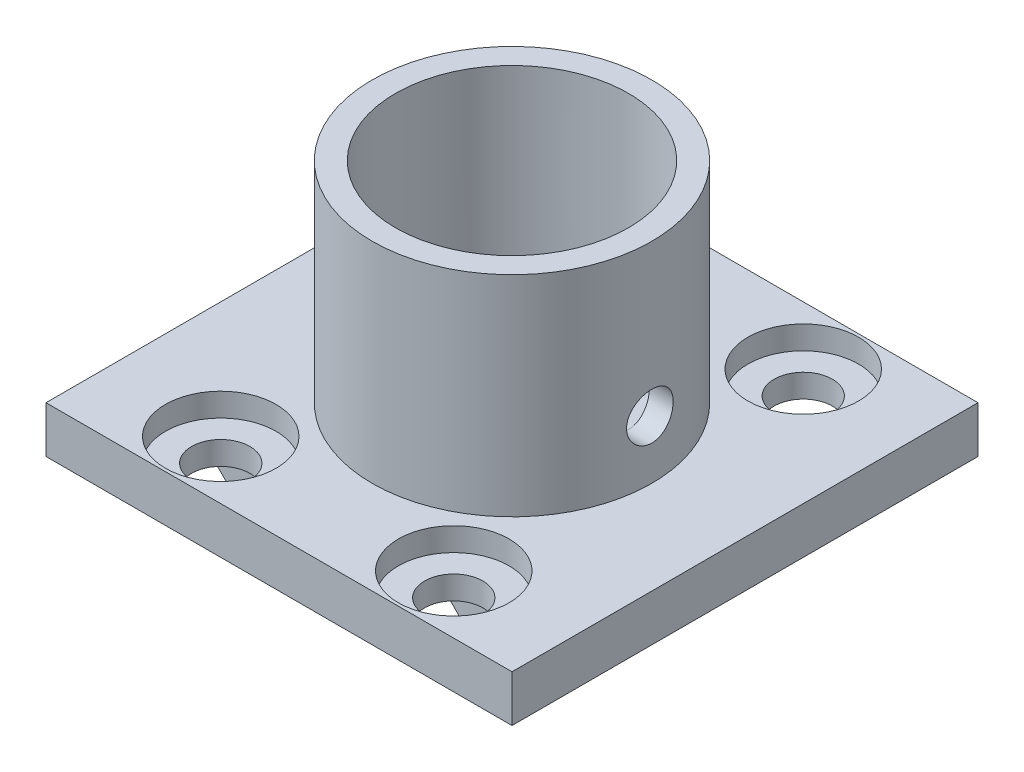
from build123d import *

# Parameters (mm, degrees)
BOSS_EXTRUDE1_DEPTH     = 40
MOVE_FACE1_DEPTH        = 40
SKETCH2_OUTSIDE_W       = 54.614
SKETCH2_OUTSIDE_H       = 54.614
SKETCH2_OUTSIDE_W_2     = 40
SKETCH2_OUTSIDE_H_2     = 20
CUT_EXTRUDE1_DEPTH      = 51.372492072
SKETCH3_R               = 10
CUT_EXTRUDE2_DEPTH      = 15
CUT_EXTRUDE3_REACH      = 78.837
CUT_EXTRUDE3_END_RADIUS = 10
SKETCH4_R               = 2
SKETCH5_R               = 2
CUT_EXTRUDE4_DEPTH      = 51.372492116
SKETCH6_R               = 4
CUT_EXTRUDE5_DEPTH      = 4
SKETCH7_OUTSIDE_W       = 54.614
SKETCH7_OUTSIDE_H       = 54.614
SKETCH7_OUTSIDE_R       = 12
CUT_EXTRUDE6_DEPTH      = 18
SKETCH8_R               = 2.5
CUT_EXTRUDE9_DEPTH      = 49.758465533
SKETCH9_R               = 4.75
CUT_EXTRUDE10_DEPTH     = 2


# Read off the part's stored shape, not the designer's step: Move Face1
with BuildPart() as part:
    # Sketch1 → Boss-Extrude1 (new body)
    with BuildSketch(Plane.XY):
        Polygon((-15.872908622, 29.998965851), (-14.072908622, 28.198965851), (-16.792908622, 28.198965851), (-16.792908622, 26.558965851), (-14.132908622, 23.898965851), (-8.452908622, 23.898965851), (-5.792908622, 26.558965851), (-5.792908622, 28.198965851), (-8.512908622, 28.198965851), (-6.712908622, 29.998965851), (4.127091378, 29.998965851), (5.927091378, 28.198965851), (3.207091378, 28.198965851), (3.207091378, 26.558965851), (5.867091378, 23.898965851), (11.547091378, 23.898965851), (14.207091378, 26.558965851), (14.207091378, 28.198965851), (11.487091378, 28.198965851), (13.287091378, 29.998965851), (18.707091378, 29.998965851), (18.707091378, 51.998965851), (-21.292908622, 51.998965851), (-21.292908622, 29.998965851), align=None)
    extrude(amount=BOSS_EXTRUDE1_DEPTH)

    # Move Face1 outline → Move Face1 (cut)
    with BuildSketch(Plane.XY):
        Polygon((-16.592908622, 27.998965851), (-13.590065909, 27.998965851), (-15.590065909, 29.998965851), (-15.872908622, 29.998965851), (-14.072908622, 28.198965851), (-16.792908622, 28.198965851), (-16.792908622, 26.558965851), (-14.132908622, 23.898965851), (-8.452908622, 23.898965851), (-5.792908622, 26.558965851), (-5.792908622, 28.198965851), (-8.512908622, 28.198965851), (-6.712908622, 29.998965851), (-6.995751334, 29.998965851), (-8.995751334, 27.998965851), (-5.992908622, 27.998965851), (-5.992908622, 26.641808564), (-8.535751334, 24.098965851), (-14.050065909, 24.098965851), (-16.592908622, 26.641808564), align=None)
        Polygon((4.409934091, 29.998965851), (4.127091378, 29.998965851), (5.927091378, 28.198965851), (3.207091378, 28.198965851), (3.207091378, 26.558965851), (5.867091378, 23.898965851), (11.547091378, 23.898965851), (14.207091378, 26.558965851), (14.207091378, 28.198965851), (11.487091378, 28.198965851), (13.287091378, 29.998965851), (13.004248666, 29.998965851), (11.004248666, 27.998965851), (14.007091378, 27.998965851), (14.007091378, 26.641808564), (11.464248666, 24.098965851), (5.949934091, 24.098965851), (3.407091378, 26.641808564), (3.407091378, 27.998965851), (6.409934091, 27.998965851), align=None)
    extrude(amount=MOVE_FACE1_DEPTH, mode=Mode.SUBTRACT)

    # Sketch2 outside → Cut-Extrude1 (cut, through all)
    with BuildSketch(Plane.XZ.offset(-29.998965851)):
        with Locations((-1.293, 20)):
            Rectangle(SKETCH2_OUTSIDE_W, SKETCH2_OUTSIDE_H)
        with Locations((-1.292908622, 20)):
            Rectangle(SKETCH2_OUTSIDE_W_2, SKETCH2_OUTSIDE_H_2, mode=Mode.SUBTRACT)
    extrude(amount=CUT_EXTRUDE1_DEPTH, mode=Mode.SUBTRACT)

    # Sketch3 → Cut-Extrude2 (cut)
    with BuildSketch(Plane(origin=(0, 51.998965851, 0), x_dir=(1, 0, 0), z_dir=(0, 1, 0))):
        with Locations(Location((-1.292908622, -20, 0), (0, 0, 270))):
            Circle(SKETCH3_R)
    extrude(amount=-CUT_EXTRUDE2_DEPTH, mode=Mode.SUBTRACT)

    # Cut-Extrude3: up to this cylinder (the profile starts outside it)
    cut_extrude3_end = Plane(origin=(-1.292908622, 38.998966, 20), z_dir=(0, 1, 0)) * Cylinder(CUT_EXTRUDE3_END_RADIUS, 178.674, mode=Mode.PRIVATE)
    # Sketch4 → Cut-Extrude3 (cut, up to the surface)
    with BuildSketch(Plane(origin=(18.707091378, 0, 0), x_dir=(0, 0, -1), z_dir=(1, 0, 0)), mode=Mode.PRIVATE) as cut_extrude3_sk1:
        with Locations(Location((-20, 38.998965851, 0), (0, 0, 90))):
            Circle(SKETCH4_R)
    cut_extrude3_tool1 = extrude(cut_extrude3_sk1.sketch, amount=-CUT_EXTRUDE3_REACH, mode=Mode.PRIVATE) - cut_extrude3_end
    add(cut_extrude3_tool1.solids().sort_by_distance((18.707091, 38.998966, 20))[0], mode=Mode.SUBTRACT)

    # Sketch5 → Cut-Extrude4 (cut, through all)
    with BuildSketch(Plane.XZ.offset(-29.998965851)):
        with Locations((-1.292908622, 20)):
            Circle(SKETCH5_R)
    extrude(amount=-CUT_EXTRUDE4_DEPTH, mode=Mode.SUBTRACT)

    # Sketch6 → Cut-Extrude5 (cut)
    with BuildSketch(Plane.XZ.offset(-29.998965851)):
        with Locations((-1.292908622, 20)):
            Circle(SKETCH6_R)
    extrude(amount=-CUT_EXTRUDE5_DEPTH, mode=Mode.SUBTRACT)

    # Sketch7 outside → Cut-Extrude6 (cut)
    with BuildSketch(Plane(origin=(0, 51.998965851, 0), x_dir=(1, 0, 0), z_dir=(0, 1, 0))):
        with Locations((-1.293, -20)):
            Rectangle(SKETCH7_OUTSIDE_W, SKETCH7_OUTSIDE_H)
        with Locations(Location((-1.292908622, -20, 0), (0, 0, 270))):
            Circle(SKETCH7_OUTSIDE_R, mode=Mode.SUBTRACT)
    extrude(amount=-CUT_EXTRUDE6_DEPTH, mode=Mode.SUBTRACT)

    # Sketch8 → Cut-Extrude9 (cut, through all)
    with BuildSketch(Plane(origin=(0, 33.998965851, 0), x_dir=(1, 0, 0), z_dir=(0, 1, 0))):
        with Locations(Location((8.707091378, -5, 0), (0, 0, 270))):
            Circle(SKETCH8_R)
        with Locations(Location((-11.292908622, -5, 0), (0, 0, 270))):
            Circle(SKETCH8_R)
        with Locations(Location((-11.292908622, -35, 0), (0, 0, 270))):
            Circle(SKETCH8_R)
        with Locations(Location((8.707091378, -35, 0), (0, 0, 270))):
            Circle(SKETCH8_R)
    extrude(amount=-CUT_EXTRUDE9_DEPTH, mode=Mode.SUBTRACT)

    # Sketch9 → Cut-Extrude10 (cut)
    with BuildSketch(Plane(origin=(0, 33.998965851, 0), x_dir=(1, 0, 0), z_dir=(0, 1, 0))):
        with Locations(Location((8.707091378, -5, 0), (0, 0, 270))):
            Circle(SKETCH9_R)
        with Locations(Location((8.707091378, -35, 0), (0, 0, 270))):
            Circle(SKETCH9_R)
        with Locations(Location((-11.292908622, -35, 0), (0, 0, 270))):
            Circle(SKETCH9_R)
        with Locations(Location((-11.292908622, -5, 0), (0, 0, 270))):
            Circle(SKETCH9_R)
    extrude(amount=-CUT_EXTRUDE10_DEPTH, mode=Mode.SUBTRACT)


solid = part.part
